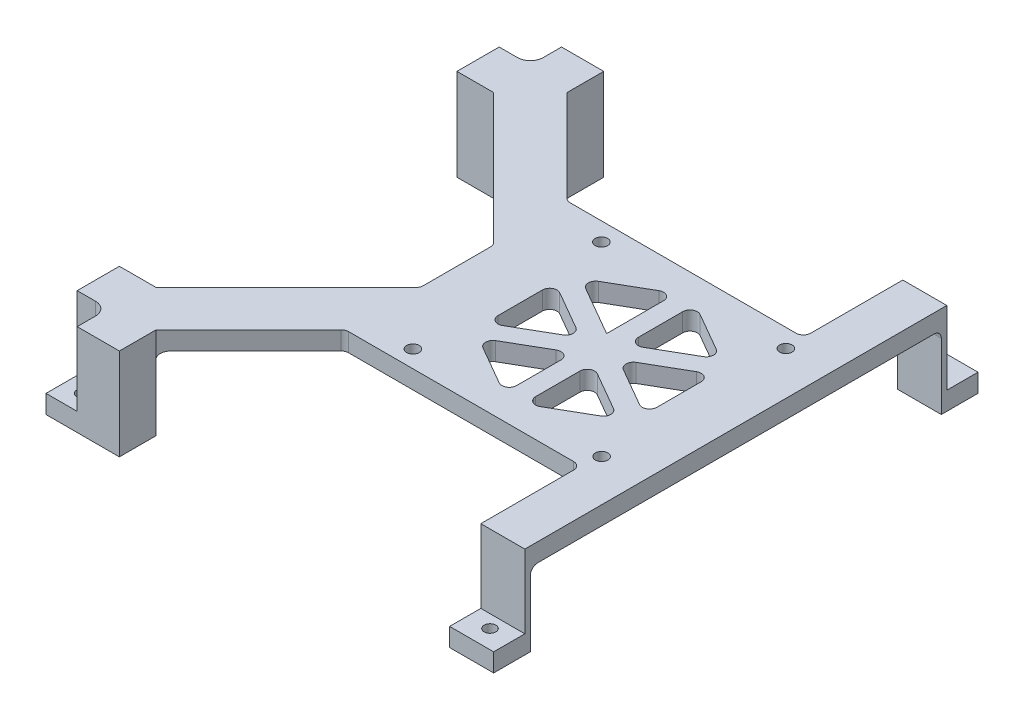
from build123d import *

# Parameters (mm, degrees)
BOSS_EXTRU_1_DEPTH      = 25
ESQUISSE1_W             = 12
ESQUISSE1_H             = 10
BOSS_EXTRU_1_2_DEPTH    = 25
BOSS_EXTRU_1_3_DEPTH    = 25
BOSS_EXTRU_1_4_DEPTH    = 25
BOSS_EXTRU_2_DEPTH      = 5
ENL_V_MAT_EXTRU_1_DEPTH = 20
ENL_V_MAT_EXTRU_6_DEPTH = 20
ESQUISSE7_W             = 12
ESQUISSE7_H             = 8.5
ENL_V_MAT_EXTRU_7_DEPTH = 20
ESQUISSE8_W             = 12
ESQUISSE8_H             = 8.5
ENL_V_MAT_EXTRU_8_DEPTH = 20
D_GAGEMENT_M31_D        = 3.4
D_GAGEMENT_M33_D        = 3.2
ENL_V_MAT_EXTRU_5_REACH = 96.768
BOSS_EXTRU_5_DEPTH      = 5
CONG_6_R                = 2


with BuildPart() as part:
    # Esquisse1 → Boss.-Extru.1 (new body)
    with BuildSketch(Plane(origin=(0, 0, 0), x_dir=(1, 0, 0), z_dir=(0, 1, 0))):
        Polygon((-55, -46), (-65, -46), (-65, -66), (-45, -66), (-45, -56), (-55, -56), align=None)
    extrude(amount=BOSS_EXTRU_1_DEPTH)



with BuildPart() as body_2:
    # Esquisse1 → Boss.-Extru.1 2 (new body)
    with BuildSketch(Plane(origin=(0, 0, 0), x_dir=(1, 0, 0), z_dir=(0, 1, 0))):
        with Locations((51, -61)):
            Rectangle(ESQUISSE1_W, ESQUISSE1_H)
    extrude(amount=BOSS_EXTRU_1_2_DEPTH)


with BuildPart() as body_3:
    # Esquisse1 → Boss.-Extru.1 3 (new body)
    with BuildSketch(Plane(origin=(0, 0, 0), x_dir=(1, 0, 0), z_dir=(0, 1, 0))):
        with Locations((51, 61)):
            Rectangle(ESQUISSE1_W, ESQUISSE1_H)
    extrude(amount=BOSS_EXTRU_1_3_DEPTH)


with BuildPart() as body_4:
    # Esquisse1 → Boss.-Extru.1 4 (new body)
    with BuildSketch(Plane(origin=(0, 0, 0), x_dir=(1, 0, 0), z_dir=(0, 1, 0))):
        Polygon((-55, 56), (-45, 56), (-45, 66), (-65, 66), (-65, 46), (-55, 46), align=None)
    extrude(amount=BOSS_EXTRU_1_4_DEPTH)


with BuildPart() as part_1:
    add(part.part)

    add(body_2.part)  # Boss.-Extru.2 merges body 2

    add(body_3.part)  # Boss.-Extru.2 merges body 3

    add(body_4.part)  # Boss.-Extru.2 merges body 4
    # Esquisse3 → Boss.-Extru.2 (add)
    with BuildSketch(Plane(origin=(0, 25, 0), x_dir=(1, 0, 0), z_dir=(0, 1, 0))):
        Polygon((-19.19198425, -30.19198425), (-45, -56), (-55, -56), (-55, -46), (-19, -10), (-19, 10), (-55, 46), (-55, 56), (-45, 56), (-19.409259157, 30.409259157), (45, 30.409259157), (45, 56), (57, 56), (57, -56), (45, -56), (45, -30.19198425), align=None)
    extrude(amount=-BOSS_EXTRU_2_DEPTH)

    # Esquisse5 → Enlèv. mat.-Extru.1 (cut)
    with BuildSketch(Plane.XZ.offset(-25)):
        with BuildLine():
            Line((-65, 66), (-56.5, 66))
            Line((-56.5, 66), (-56.5, 61))
            ThreePointArc((-56.5, 61), (-57.525126266, 58.525126266), (-60, 57.5))
            Line((-60, 57.5), (-65, 57.5))
            Line((-65, 57.5), (-65, 66))
        make_face()
    extrude(amount=ENL_V_MAT_EXTRU_1_DEPTH, mode=Mode.SUBTRACT)

    # Esquisse6 → Enlèv. mat.-Extru.6 (cut)
    with BuildSketch(Plane.XZ.offset(-25)):
        with BuildLine():
            Line((-65, -66), (-56.5, -66))
            Line((-56.5, -66), (-56.5, -61))
            ThreePointArc((-56.5, -61), (-57.525126266, -58.525126266), (-60, -57.5))
            Line((-60, -57.5), (-65, -57.5))
            Line((-65, -57.5), (-65, -66))
        make_face()
    extrude(amount=ENL_V_MAT_EXTRU_6_DEPTH, mode=Mode.SUBTRACT)

    # Esquisse7 → Enlèv. mat.-Extru.7 (cut)
    with BuildSketch(Plane.XZ.offset(-25)):
        with Locations((51, -61.75)):
            Rectangle(ESQUISSE7_W, ESQUISSE7_H)
    extrude(amount=ENL_V_MAT_EXTRU_7_DEPTH, mode=Mode.SUBTRACT)

    # Esquisse8 → Enlèv. mat.-Extru.8 (cut)
    with BuildSketch(Plane.XZ.offset(-25)):
        with Locations((51, 61.75)):
            Rectangle(ESQUISSE8_W, ESQUISSE8_H)
    extrude(amount=ENL_V_MAT_EXTRU_8_DEPTH, mode=Mode.SUBTRACT)

    # Dégagement M31 (through all)
    with Locations(Plane(origin=(0, 20, 0), x_dir=(-1, 0, 0), z_dir=(0, -1, 0))):
        with Locations((5.03960108, 25.409259157), (-45.237035753, 25.409259157), (-45.60269612, -25.19198425), (5.470441433, -25.527464352)):
            Hole(D_GAGEMENT_M31_D / 2)

    # Dégagement M33 (through all)
    with Locations(Plane(origin=(0, 5, 0), x_dir=(1, 0, 0), z_dir=(0, 1, 0))):
        with Locations((-60, 61), (51, 61), (51, -61), (-60, -61)):
            Hole(D_GAGEMENT_M33_D / 2)

    # Esquisse26 → Enlèv. mat.-Extru.5 (cut, up to next)
    with BuildSketch(Plane(origin=(0, 20, 0), x_dir=(-1, 0, 0), z_dir=(0, -1, 0)), mode=Mode.PRIVATE) as enl_v_mat_extru_5_sk1:
        Polygon((-41.533933741, 12.500000858), (-41.533933741, -12.500000858), (-19.88329716, -25.000001716), (1.767339421, -12.500000858), (1.767339421, 12.500000858), (-19.88329716, 25.000001716), align=None)
    enl_v_mat_extru_5_tool1 = extrude(enl_v_mat_extru_5_sk1.sketch, amount=-ENL_V_MAT_EXTRU_5_REACH, mode=Mode.PRIVATE) & part_1.part
    add(enl_v_mat_extru_5_tool1.solids().sort_by_distance((19.883297, 20, 0))[0], mode=Mode.SUBTRACT)

    # Esquisse27 → Boss.-Extru.5 (add)
    with BuildSketch(Plane(origin=(0, 20, 0), x_dir=(-1, 0, 0), z_dir=(0, -1, 0))):
        Polygon((-22.481373371, -23.500001716), (-19.88329716, -25.000001716), (-17.285220949, -23.500001716), (-17.285220949, -4.5), (-0.830736791, -14.000000858), (1.767339421, -12.500000858), (1.767339421, -9.500000858), (-14.687144737, 0), (1.767339421, 9.500000858), (1.767339421, 12.500000858), (-0.830736791, 14.000000858), (-17.285220949, 4.5), (-17.285220949, 23.500001716), (-19.88329716, 25.000001716), (-22.481373371, 23.500001716), (-22.481373371, 4.5), (-38.935857529, 14.000000858), (-41.533933741, 12.500000858), (-41.533933741, 9.500000858), (-25.079449583, 0), (-41.533933741, -9.500000858), (-41.533933741, -12.500000858), (-38.935857529, -14.000000858), (-22.481373371, -4.5), align=None)
    extrude(amount=-BOSS_EXTRU_5_DEPTH)

    # Congé6
    cong_6_edges = [part_1.edges().sort_by_distance(p)[0] for p in [
        (17.285220949, 22.5, 4.5),
        (14.687144737, 22.5, 0),
        (0.830736791, 22.5, -14.000000858),
        (22.481373371, 22.5, -23.500001716),
        (38.935857529, 22.5, -14.000000858),
        (41.533933741, 22.5, -9.500000858),
        (41.533933741, 22.5, 9.500000858),
        (17.285220949, 22.5, 23.500001716),
        (0.830736791, 22.5, 14.000000858),
        (38.935857529, 22.5, 14.000000858),
        (22.481373371, 22.5, 23.500001716),
        (-1.767339421, 22.5, -9.500000858),
        (45, 22.5, 30.19198425),
        (-19.19198425, 22.5, 30.19198425),
        (51, 20, 56),
        (-50, 20, 56),
        (-55, 20, 51),
        (-19, 22.5, -10),
        (-19, 22.5, 10),
        (45, 22.5, -30.409259157),
        (-19.409259157, 22.5, -30.409259157),
        (25.079449583, 22.5, 0),
        (22.481373371, 22.5, -4.5),
        (-1.767339421, 22.5, 9.500000858),
        (22.481373371, 22.5, 4.5),
        (17.285220949, 22.5, -23.500001716),
        (51, 20, -56),
    ]]
    fillet(cong_6_edges, radius=CONG_6_R)


solid = part_1.part
